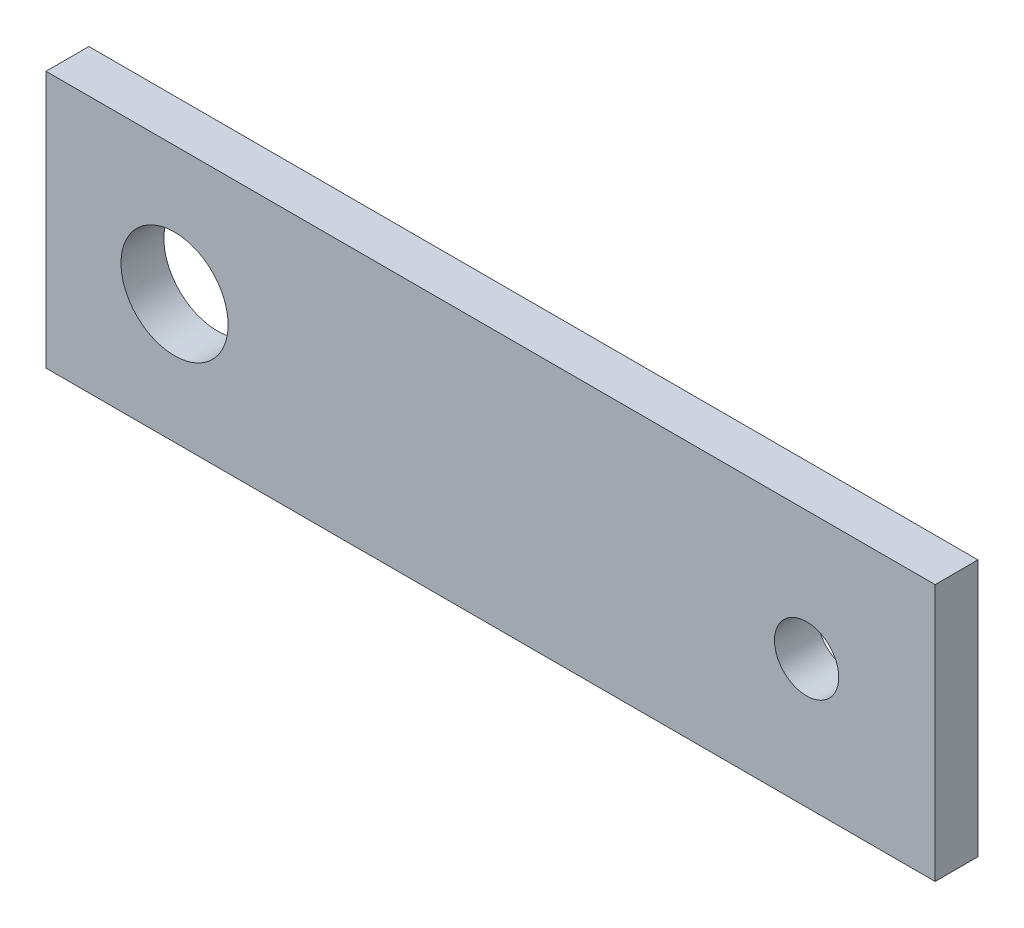
from build123d import *

# Parameters (mm, degrees)
SKETCH_1_W      = 83
SKETCH_1_H      = 24
SKETCH_1_R      = 5
SKETCH_1_R_2    = 3
EXTRUDE_1_DEPTH = 2


with BuildPart() as part:
    # 草图1 → 凸台-拉伸1 (new, symmetric)
    with BuildSketch(Plane.XY):
        with Locations((29.5, 0)):
            Rectangle(SKETCH_1_W, SKETCH_1_H)
        Circle(SKETCH_1_R, mode=Mode.SUBTRACT)
        with Locations((59, 0)):
            Circle(SKETCH_1_R_2, mode=Mode.SUBTRACT)
    extrude(amount=EXTRUDE_1_DEPTH, both=True)


solid = part.part
